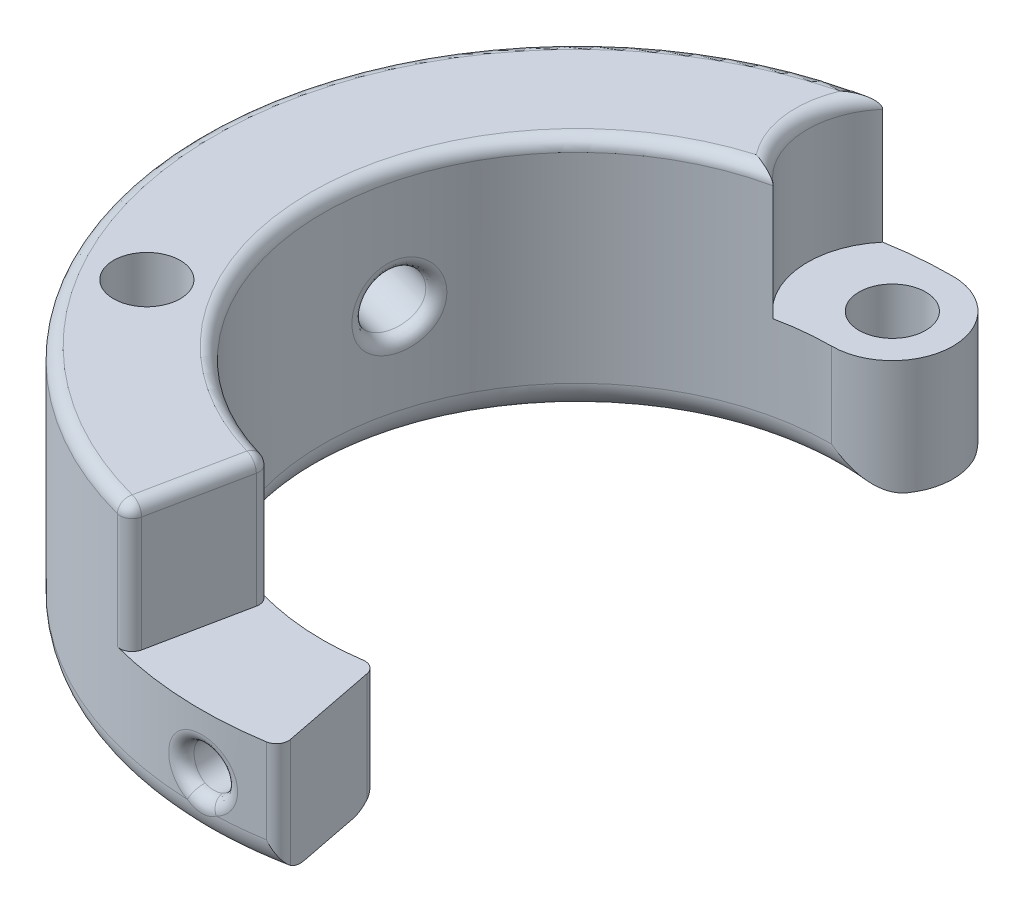
from build123d import *

# Parameters (mm, degrees)
SKETCH1_R               = 2.75
BOSS_EXTRUDE1_DEPTH     = 20
SKETCH3_R               = 1.75
CUT_EXTRUDE2_DEPTH      = 71
CUT_EXTRUDE1_START      = -10.5
SKETCH2_R               = 2.75
CUT_EXTRUDE1_DEPTH      = 10.5
SKETCH4_R               = 2.75
BOSS_EXTRUDE2_DEPTH     = 3
FILLET2_R               = 1
CUT_EXTRUDE3_DEPTH      = 48.442658328
CUT_EXTRUDE3_DEPTH_BACK = 48.442658328
SKETCH5_R               = 2.35
FILLET3_R               = 1


with BuildPart() as part:
    # Sketch1 → Boss-Extrude1 (new body)
    with BuildSketch(Plane(origin=(0, 0, 0), x_dir=(1, 0, 0), z_dir=(0, 1, 0))):
        with BuildLine():
            Line((4.226396342, -21.567048337), (5.76602475, -29.423680235))
            ThreePointArc((5.76602475, -29.423680235), (5.605165184, -30.187670173), (4.944179741, -30.603187525))
            ThreePointArc((4.944179741, -30.603187525), (2.480038984, -30.900637641), (0, -31))
            ThreePointArc((0, -31), (-31, 0), (0, 31))
            ThreePointArc((0, 31), (5, 26), (0, 21))
            ThreePointArc((0, 21), (-21, 0), (0, -21))
            ThreePointArc((0, -21), (1.55303216, -20.942494864), (3.09755886, -20.770294391))
            ThreePointArc((3.09755886, -20.770294391), (3.821709833, -20.942363441), (4.226396342, -21.567048337))
        make_face()
        with Locations(Location((0, 26, 0), (0, 0, 270))):
            Circle(SKETCH1_R, mode=Mode.SUBTRACT)
        with Locations(Location((-22.516660498, -13, 0), (0, 0, 270))):
            Circle(SKETCH1_R, mode=Mode.SUBTRACT)
    extrude(amount=BOSS_EXTRUDE1_DEPTH)

    # Sketch3 → Cut-Extrude2 (cut)
    with BuildSketch(Plane.XY):
        with Locations(Location((0, 15, 0), (0, 0, 180))):
            Circle(SKETCH3_R)
        with Locations(Location((0, 5, 0), (0, 0, 180))):
            Circle(SKETCH3_R)
    extrude(amount=CUT_EXTRUDE2_DEPTH, mode=Mode.SUBTRACT)

    # Sketch2 → Cut-Extrude1 (cut)
    # profile 1 of 2: a face of its own
    with BuildSketch(Plane(origin=(0, 20, 0), x_dir=(1, 0, 0), z_dir=(0, 1, 0)).offset(CUT_EXTRUDE1_START)):
        with BuildLine():
            ThreePointArc((4.944179741, -30.603187525), (5.605165184, -30.187670173), (5.76602475, -29.423680235))
            Line((5.76602475, -29.423680235), (4.226396342, -21.567048337))
            ThreePointArc((4.226396342, -21.567048337), (3.821709833, -20.942363441), (3.09755886, -20.770294391))
            ThreePointArc((3.09755886, -20.770294391), (-0.954545455, -20.978294568), (-4.971015974, -20.403161524))
            Line((-4.971015974, -20.403161524), (-6.97227141, -30.205751628))
            ThreePointArc((-6.97227141, -30.205751628), (-1.033333333, -30.982772991), (4.944179741, -30.603187525))
        make_face()
    # profile 2 of 2: a face of its own
    with BuildSketch(Plane(origin=(0, 20, 0), x_dir=(1, 0, 0), z_dir=(0, 1, 0)).offset(CUT_EXTRUDE1_START)):
        with BuildLine():
            ThreePointArc((0, 21), (5, 26), (0, 31))
            ThreePointArc((0, 31), (-2.674667485, 30.884399846), (-5.3293871, 30.538461538))
            ThreePointArc((-5.3293871, 30.538461538), (-6.968568999, 25.337394452), (-4.378538299, 20.538461538))
            ThreePointArc((-4.378538299, 20.538461538), (-2.201398157, 20.88429664), (0, 21))
        make_face()
        with Locations(Location((0, 26, 0), (0, 0, 270))):
            Circle(SKETCH2_R, mode=Mode.SUBTRACT)
    extrude(amount=CUT_EXTRUDE1_DEPTH, mode=Mode.SUBTRACT)

    # Sketch4 → Boss-Extrude2 (add)
    with BuildSketch(Plane.XZ):
        with Locations(Location((0, -26, 0), (0, 0, 270))):
            Circle(SKETCH4_R)
        with Locations(Location((-22.516660498, 13, 0), (0, 0, 270))):
            Circle(SKETCH4_R)
    extrude(amount=-BOSS_EXTRUDE2_DEPTH)

    # Fillet1: read off the stored shape, not the designer's step
    # Fillet1 outline → Fillet1 (revolve, cut)
    with BuildSketch(Plane.XY):
        with BuildLine():
            ThreePointArc((31, 2.5), (30.267766953, 0.732233047), (28.5, 0))
            Line((28.5, 0), (31, 0))
            Line((31, 0), (31, 2.5))
        make_face()
        with BuildLine():
            Line((21, 0), (23.5, 0))
            ThreePointArc((23.5, 0), (21.732233047, 0.732233047), (21, 2.5))
            Line((21, 2.5), (21, 0))
        make_face()
    revolve(axis=Axis((0, 0, 0), (0, 1, 0)), mode=Mode.SUBTRACT)

    # Fillet2
    fillet2_edges = [part.edges().sort_by_distance(p)[0] for p in [
        (-30.988668232, 20, -0.838117644),
        (-20.997801457, 20, -0.303865056),
        (-5.971643692, 20, 25.304456576),
        (-6.968568999, 20, -25.337394452),
        (-4.971015974, 14.75, 20.403161524),
        (-6.97227141, 14.75, 30.205751628),
    ]]
    fillet(fillet2_edges, radius=FILLET2_R)

    # Sketch5 → Cut-Extrude3 (cut, two sides: drawn at the far end of the back side and taken through both)
    with BuildSketch(Plane(origin=(-22.19157709, 0, 1.682323793), x_dir=(0.25881904510252135, 0, -0.9659258262890681), z_dir=(0.9659258262890681, 0, 0.25881904510252135)).offset(-CUT_EXTRUDE3_DEPTH_BACK)):
        with Locations((7.368602792, 10)):
            Circle(SKETCH5_R)
    extrude(amount=CUT_EXTRUDE3_DEPTH + CUT_EXTRUDE3_DEPTH_BACK, mode=Mode.SUBTRACT)

    # Fillet3
    fillet3_edges = [part.edges().sort_by_distance(p)[0] for p in [
        (-20.765259234, 10.000000521, -3.131135419),
        (-30.465763903, 10.000000002, -5.730377811),
        (1.750000011, 5.000000001, 30.950565422),
        (1.75, 5, 20.9269563),
    ]]
    fillet(fillet3_edges, radius=FILLET3_R)


solid = part.part
